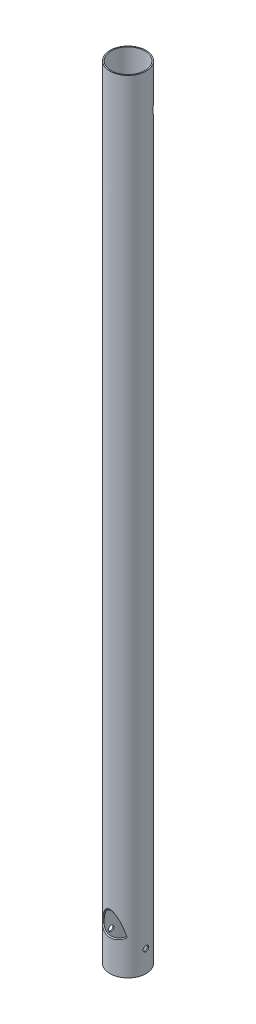
from build123d import *

# Parameters (mm, degrees)
EXTRUDE_1_OUTLINE_R      = 66.5
EXTRUDE_1_OUTLINE_R_2    = 62.5
EXTRUDE_1_DEPTH          = 2880
CUT_EXTRUDE_3_DEPTH      = 2882.535094355
CUT_EXTRUDE_3_DEPTH_BACK = 2882.535094355
SKETCH_6_R               = 10
SKETCH_7_R               = 50
CUT_EXTRUDE_4_DEPTH      = 200
SKETCH_10_R              = 55
CUT_EXTRUDE_5_DEPTH      = 2882.53509446
SKETCH_13_R              = 52.5
CUT_EXTRUDE_8_DEPTH      = 200


# Read off the part's stored shape, not the designer's step: Вытянуть-Тонкостенный1
with BuildPart() as part:
    # Вытянуть-Тонкостенный1 outline → Вытянуть-Тонкостенный1 (new body)
    with BuildSketch(Plane(origin=(0, 0, 0), x_dir=(1, 0, 0), z_dir=(0, 1, 0))):
        Circle(EXTRUDE_1_OUTLINE_R)
        Circle(EXTRUDE_1_OUTLINE_R_2, mode=Mode.SUBTRACT)
    extrude(amount=EXTRUDE_1_DEPTH)

    # Эскиз6 → Вырез-Вытянуть3 (cut, two sides: drawn at the far end of the back side and taken through both)
    with BuildSketch(Plane(origin=(0, 0, 0), x_dir=(0, 0, -1), z_dir=(1, 0, 0)).offset(-CUT_EXTRUDE_3_DEPTH_BACK)):
        with Locations((0, 80)):
            Circle(SKETCH_6_R)
    extrude(amount=CUT_EXTRUDE_3_DEPTH + CUT_EXTRUDE_3_DEPTH_BACK, mode=Mode.SUBTRACT)

    # Эскиз7 → Вырез-Вытянуть4 (cut)
    with BuildSketch(Plane(origin=(0, 272.455155936, 190.775154011), x_dir=(1, 0, 0), z_dir=(0, -0.8191520442889889, -0.5735764363510502))):
        with Locations((0, -13.154034206)):
            Circle(SKETCH_7_R)
    extrude(amount=CUT_EXTRUDE_4_DEPTH, mode=Mode.SUBTRACT)

    # Эскиз10 → Вырез-Вытянуть5 (cut, through all)
    with BuildSketch(Plane.XY):
        with Locations(Location((0, 2730, 0), (0, 0, 90))):
            Circle(SKETCH_10_R)
    extrude(amount=-CUT_EXTRUDE_5_DEPTH, mode=Mode.SUBTRACT)

    # Эскиз13 → Вырез-Вытянуть8 (cut)
    with BuildSketch(Plane(origin=(0, 1600.798061382, 1120.890869731), x_dir=(1, 0, 0), z_dir=(0, -0.8191520442889889, -0.5735764363510502))):
        with Locations((0, -1588.09451652)):
            Circle(SKETCH_13_R)
    extrude(amount=-CUT_EXTRUDE_8_DEPTH, mode=Mode.SUBTRACT)


solid = part.part
